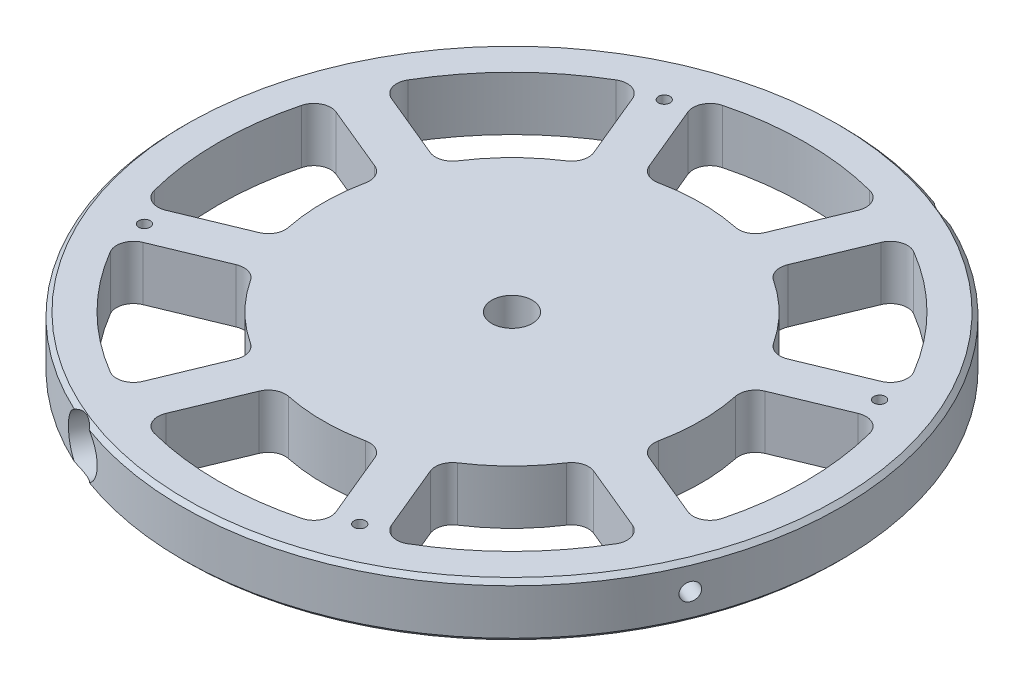
from build123d import *

# Parameters (mm, degrees)
SKETCH2_W                = 77.55
SKETCH2_H                = 12.7
F_6_32_TAPPED_HOLE2_D    = 2.7051
CIRPATTERN3_COUNT        = 4
CUT_EXTRUDE1_DEPTH       = 111.405140279
FILLET1_R                = 4
CIRPATTERN4_COUNT        = 8
FILLET1_OF_CIRPATTERN4_R = 4
CHAMFER1_SIZE            = 1
SKETCH15_W               = 2.0447
SKETCH15_H               = 101.323957926
SKETCH19_R               = 6.25
CUT_EXTRUDE3_DEPTH       = 5
CIRPATTERN5_COUNT        = 2
CIRPATTERN6_COUNT        = 2
SKETCH22_R               = 4.765
CUT_EXTRUDE4_DEPTH       = 12.8


with BuildPart() as part:
    # Sketch2 → Revolve1 (revolve)
    with BuildSketch(Plane(origin=(0, 0, 0), x_dir=(0, 0, -1), z_dir=(1, 0, 0))):
        with Locations((-38.775, 6.35)):
            Rectangle(SKETCH2_W, SKETCH2_H)
    revolve(axis=Axis((0, -0.888756804, 0), (0, 1, 0)))

    # #6-32 Tapped Hole2 (through all)
    with Locations(Plane(origin=(0, 12.7, 0), x_dir=(1, 0, 0), z_dir=(0, 1, 0))):
        with Locations((-25.333643223, 61.160825052)):
            f_6_32_tapped_hole2 = Hole(F_6_32_TAPPED_HOLE2_D / 2)

    # CirPattern3: #6-32 Tapped Hole2 ×4 about axis
    cirpattern3_axis = Axis((0, -0.888756804, 0), (0, 1, 0))
    for i in range(1, CIRPATTERN3_COUNT):
        add(f_6_32_tapped_hole2.rotate(cirpattern3_axis, i * 360 / CIRPATTERN3_COUNT), mode=Mode.SUBTRACT)

    # Sketch8 → Cut-Extrude1 (cut, through all)
    with BuildSketch(Plane(origin=(0, 12.7, 0), x_dir=(1, 0, 0), z_dir=(0, 1, 0))):
        with BuildLine():
            Line((-12.282922052, 42.719226653), (-21.735525784, 65.539830782))
            ThreePointArc((-21.735525784, 65.539830782), (0, 69.05), (21.735525784, 65.539830782))
            Line((21.735525784, 65.539830782), (12.282922052, 42.719226653))
            ThreePointArc((12.282922052, 42.719226653), (0, 44.45), (-12.282922052, 42.719226653))
        make_face()
    cut_extrude1 = extrude(amount=-CUT_EXTRUDE1_DEPTH, mode=Mode.SUBTRACT)

    # Fillet1
    fillet1_edges = [part.edges().sort_by_distance(p)[0] for p in [
        (12.282922052, 6.35, -42.719226653),
        (21.735525784, 6.35, -65.539830782),
        (-12.282922052, 6.35, -42.719226653),
        (-21.735525784, 6.35, -65.539830782),
    ]]
    fillet(fillet1_edges, radius=FILLET1_R)

    # CirPattern4: Cut-Extrude1 ×8 about axis
    cirpattern4_axis = Axis((0, -0.888756804, 0), (0, 1, 0))
    for i in range(1, CIRPATTERN4_COUNT):
        add(cut_extrude1.rotate(cirpattern4_axis, i * 360 / CIRPATTERN4_COUNT), mode=Mode.SUBTRACT)

    # Fillet1 of CirPattern4
    fillet1_of_cirpattern4_edges = [part.edges().sort_by_distance(p)[0] for p in [
        (-21.521717378, 6.35, -38.89239233),
        (-30.974321109, 6.35, -61.712996458),
        (-38.89239233, 6.35, -21.521717378),
        (-61.712996458, 6.35, -30.974321109),
        (-42.719226653, 6.35, -12.282922052),
        (-65.539830782, 6.35, -21.735525784),
        (-42.719226653, 6.35, 12.282922052),
        (-65.539830782, 6.35, 21.735525784),
        (-38.89239233, 6.35, 21.521717378),
        (-61.712996458, 6.35, 30.974321109),
        (-21.521717378, 6.35, 38.89239233),
        (-30.974321109, 6.35, 61.712996458),
        (-12.282922052, 6.35, 42.719226653),
        (-21.735525784, 6.35, 65.539830782),
        (12.282922052, 6.35, 42.719226653),
        (21.735525784, 6.35, 65.539830782),
        (21.521717378, 6.35, 38.89239233),
        (30.974321109, 6.35, 61.712996458),
        (38.89239233, 6.35, 21.521717378),
        (61.712996458, 6.35, 30.974321109),
        (42.719226653, 6.35, 12.282922052),
        (65.539830782, 6.35, 21.735525784),
        (42.719226653, 6.35, -12.282922052),
        (65.539830782, 6.35, -21.735525784),
        (38.89239233, 6.35, -21.521717378),
        (61.712996458, 6.35, -30.974321109),
        (21.521717378, 6.35, -38.89239233),
        (30.974321109, 6.35, -61.712996458),
    ]]
    fillet(fillet1_of_cirpattern4_edges, radius=FILLET1_OF_CIRPATTERN4_R)

    # Chamfer1
    chamfer1_edges = [part.edges().sort_by_distance(p)[0] for p in [
        (0, 0, -77.55),
        (0, 12.7, -77.55),
    ]]
    chamfer(chamfer1_edges, length=CHAMFER1_SIZE)

    # Sketch15 → #20 (0.161) Diameter Hole1 (revolve, cut)
    with BuildSketch(Plane(origin=(0, 6.35, 0), x_dir=(-0.38268343236508734, 0, 0.9238795325112877), z_dir=(0, 1, 0))):
        with Locations((1.02235, 50.661978963)):
            Rectangle(SKETCH15_W, SKETCH15_H)
    revolve(axis=Axis((-5.866635031, 6.35, -2.430039796), (0.9238795325112877, 0, 0.3826834323650874)), mode=Mode.SUBTRACT)

    # Sketch19 → Cut-Extrude3 (cut)
    with BuildSketch(Plane(origin=(29.67710018, 0, -71.646857746), x_dir=(-0.9238795325112891, 0, -0.38268343236508423), z_dir=(0.38268343236508423, 0, -0.9238795325112891))):
        with Locations((0, 6.35)):
            Circle(SKETCH19_R)
    cut_extrude3 = extrude(amount=-CUT_EXTRUDE3_DEPTH, mode=Mode.SUBTRACT)

    # CirPattern5: Cut-Extrude3 ×2 about axis
    cirpattern5_axis = Axis((0, -0.888756804, 0), (0, 1, 0))
    for i in range(1, CIRPATTERN5_COUNT):
        add(cut_extrude3.rotate(cirpattern5_axis, i * 360 / CIRPATTERN5_COUNT), mode=Mode.SUBTRACT)

    # Sketch21 → #10-24 Tapped Hole1 (revolve, cut)
    with BuildSketch(Plane(origin=(-27.763683018, 6.35, 67.027460084), x_dir=(0.9238795325112891, 0, 0.38268343236508423), z_dir=(0, 1, 0))):
        Polygon((0, 0), (0, 51.940824014), (1.89865, 50.8), (1.89865, 0), align=None)
    f_10_24_tapped_hole1 = revolve(axis=Axis((-30.193722814, 6.35, 72.894095115), (0.38268343236508423, 0, -0.923879532511289)), mode=Mode.SUBTRACT)

    # CirPattern6: #10-24 Tapped Hole1 ×2 about axis
    cirpattern6_axis = Axis((0, -0.888756804, 0), (0, 1, 0))
    for i in range(1, CIRPATTERN6_COUNT):
        add(f_10_24_tapped_hole1.rotate(cirpattern6_axis, i * 360 / CIRPATTERN6_COUNT), mode=Mode.SUBTRACT)

    # Sketch22 → Cut-Extrude4 (cut)
    with BuildSketch(Plane(origin=(0, 12.7, 0), x_dir=(1, 0, 0), z_dir=(0, 1, 0))):
        Circle(SKETCH22_R)
    extrude(amount=-CUT_EXTRUDE4_DEPTH, mode=Mode.SUBTRACT)


solid = part.part
